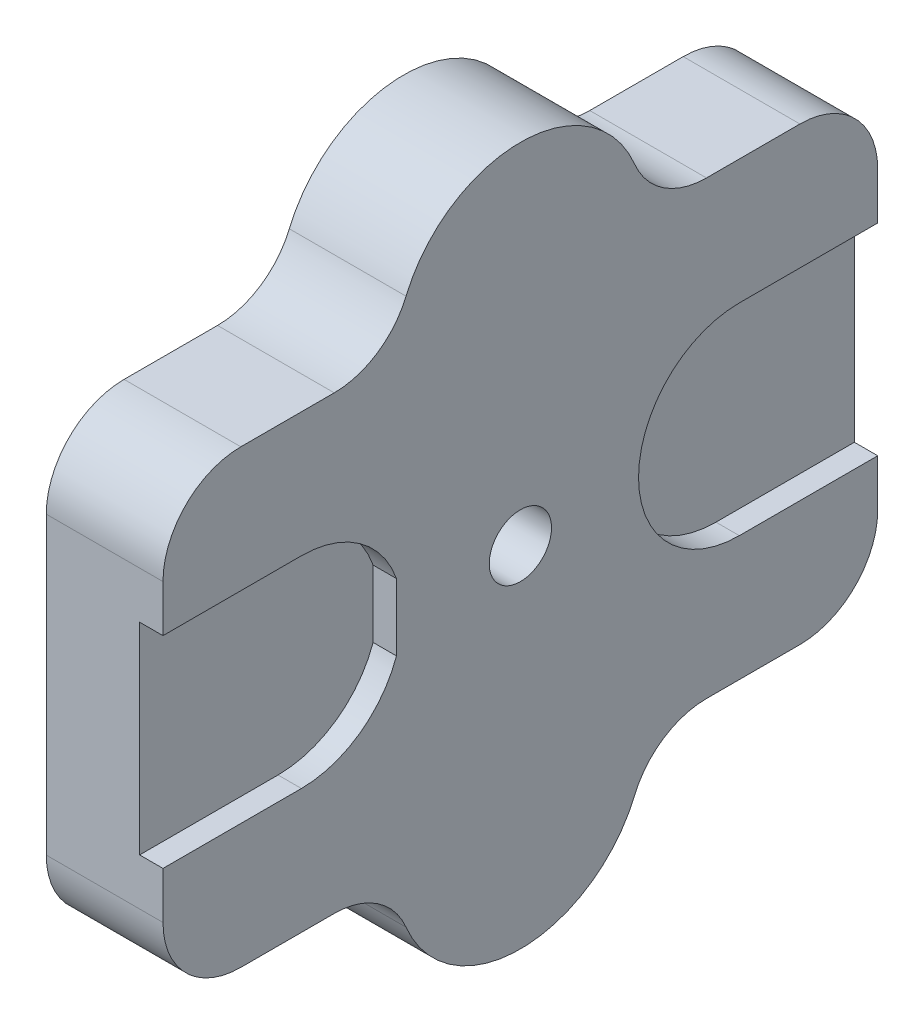
from build123d import *

# Parameters (mm, degrees)
BOSS_EXTRUDE3_DEPTH = 15
SKETCH3_R           = 4
CUT_EXTRUDE3_DEPTH  = 14.0462
CUT_EXTRUDE4_DEPTH  = 3


with BuildPart() as part:
    # Sketch1 → Boss-Extrude3 (new body)
    with BuildSketch(Plane.YZ):
        with BuildLine():
            Line((-28.968617751, -12.789334175), (28.968617751, -12.789334175))
            ThreePointArc((28.968617751, -12.789334175), (44.579120821, 0), (35.110840206, 17.821518929))
            ThreePointArc((35.110840206, 17.821518929), (30.644623053, 21.505675602), (28.968617751, 27.047436358))
            Line((28.968617751, 27.047436358), (28.968617751, 39.053986921))
            ThreePointArc((28.968617751, 39.053986921), (26.039685563, 46.125054733), (18.968617751, 49.053986921))
            Line((18.968617751, 49.053986921), (-18.968617751, 49.053986921))
            ThreePointArc((-18.968617751, 49.053986921), (-26.039685563, 46.125054733), (-28.968617751, 39.053986921))
            Line((-28.968617751, 39.053986921), (-28.968617751, 27.047436358))
            ThreePointArc((-28.968617751, 27.047436358), (-30.644623053, 21.505675602), (-35.110840206, 17.821518929))
            ThreePointArc((-35.110840206, 17.821518929), (-44.579120821, 0), (-28.968617751, -12.789334175))
        make_face()
    boss_extrude3 = extrude(amount=BOSS_EXTRUDE3_DEPTH)

    # Sketch3 → Cut-Extrude3 (cut)
    with BuildSketch(Plane.YZ.offset(15)):
        with Locations((0, 3.132326373)):
            Circle(SKETCH3_R)
    cut_extrude3 = extrude(amount=-CUT_EXTRUDE3_DEPTH, mode=Mode.SUBTRACT)

    # Sketch4 → Cut-Extrude4 (cut)
    with BuildSketch(Plane.YZ.offset(15)):
        with BuildLine():
            Line((-12.95, 49.053986921), (-12.95, 31.267703884))
            ThreePointArc((-12.95, 31.267703884), (0, 18.317703884), (12.95, 31.267703884))
            Line((12.95, 31.267703884), (12.95, 49.053986921))
            Line((12.95, 49.053986921), (-12.95, 49.053986921))
        make_face()
    cut_extrude4 = extrude(amount=-CUT_EXTRUDE4_DEPTH, mode=Mode.SUBTRACT)

    # Mirror1: Boss-Extrude3, Cut-Extrude3, Cut-Extrude4 across plane
    add(boss_extrude3.mirror(Plane.XY.offset(3.132326373)))
    add(cut_extrude3.mirror(Plane.XY.offset(3.132326373)), mode=Mode.SUBTRACT)
    add(cut_extrude4.mirror(Plane.XY.offset(3.132326373)), mode=Mode.SUBTRACT)


solid = part.part
